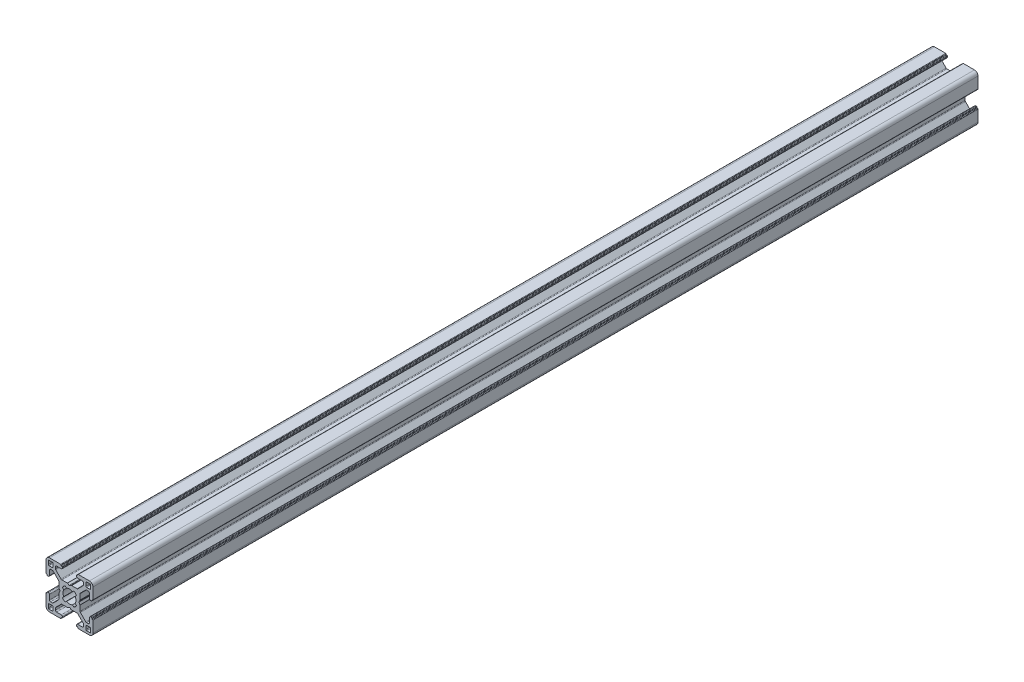
from build123d import *

# Parameters (mm, degrees)
ESTRUSIONE_ESTRUSIONE1_DEPTH = 377


with BuildPart() as part:
    # Schizzo1 → Estrusione-Estrusione1 (new body)
    with BuildSketch(Plane.XY.offset(100)):
        with BuildLine():
            Line((-9.299999732, 3), (-8.999999732, 3))
            ThreePointArc((-8.999999732, 3), (-8.646446341, 3.146446609), (-8.499999732, 3.5))
            Line((-8.499999732, 3.5), (-8.499999732, 5.499999605))
            ThreePointArc((-8.499999732, 5.499999605), (-8.353553123, 5.853552995), (-7.999999732, 5.999999605))
            Line((-7.999999732, 5.999999605), (-7.267766685, 5.999999605))
            ThreePointArc((-7.267766685, 5.999999605), (-7.076424969, 5.961939371), (-6.914213294, 5.853552995))
            Line((-6.914213294, 5.853552995), (-4.646446398, 3.585786099))
            ThreePointArc((-4.646446398, 3.585786099), (-4.538060023, 3.423574425), (-4.499999789, 3.232232708))
            Line((-4.499999789, 3.232232708), (-4.499999789, 0.953589302))
            ThreePointArc((-4.499999789, 0.953589302), (-4.493184953, 0.90182549), (-4.473204867, 0.853589297))
            Line((-4.473204867, 0.853589297), (-4.038119841, 0.099999969))
            ThreePointArc((-4.038119841, 0.099999969), (-4.011324929, 0), (-4.038119841, -0.099999969))
            Line((-4.038119841, -0.099999969), (-4.473204867, -0.853589297))
            ThreePointArc((-4.473204867, -0.853589297), (-4.493184953, -0.90182549), (-4.499999789, -0.953589302))
            Line((-4.499999789, -0.953589302), (-4.499999789, -3.232232708))
            ThreePointArc((-4.499999789, -3.232232708), (-4.538060023, -3.423574425), (-4.646446398, -3.585786099))
            Line((-4.646446398, -3.585786099), (-6.914213294, -5.853552995))
            ThreePointArc((-6.914213294, -5.853552995), (-7.076424969, -5.961939371), (-7.267766685, -5.999999605))
            Line((-7.267766685, -5.999999605), (-7.999999732, -5.999999605))
            ThreePointArc((-7.999999732, -5.999999605), (-8.353553123, -5.853552995), (-8.499999732, -5.499999605))
            Line((-8.499999732, -5.499999605), (-8.499999732, -3.5))
            ThreePointArc((-8.499999732, -3.5), (-8.646446341, -3.146446609), (-8.999999732, -3))
            Line((-8.999999732, -3), (-9.299999732, -3))
            ThreePointArc((-9.299999732, -3), (-9.441421088, -3.058578644), (-9.499999732, -3.2))
            Line((-9.499999732, -3.2), (-9.499999732, -3.349999605))
            ThreePointArc((-9.499999732, -3.349999605), (-9.558578376, -3.491420961), (-9.699999732, -3.549999605))
            Line((-9.699999732, -3.549999605), (-9.8, -3.549999605))
            ThreePointArc((-9.8, -3.549999605), (-9.941421356, -3.608578248), (-10, -3.749999605))
            Line((-10, -3.749999605), (-10, -8.5))
            ThreePointArc((-10, -8.5), (-9.560660172, -9.560660172), (-8.5, -10))
            Line((-8.5, -10), (-3.750000228, -10))
            ThreePointArc((-3.750000228, -10), (-3.608578871, -9.941421356), (-3.550000228, -9.8))
            Line((-3.550000228, -9.8), (-3.550000228, -9.7))
            ThreePointArc((-3.550000228, -9.7), (-3.491421584, -9.558578644), (-3.350000228, -9.5))
            Line((-3.350000228, -9.5), (-3.2, -9.5))
            ThreePointArc((-3.2, -9.5), (-3.058578644, -9.441421356), (-3, -9.3))
            Line((-3, -9.3), (-3, -8.999999673))
            ThreePointArc((-3, -8.999999673), (-3.146446609, -8.646446283), (-3.5, -8.499999673))
            Line((-3.5, -8.499999673), (-5.500000686, -8.499999673))
            ThreePointArc((-5.500000686, -8.499999673), (-5.853554077, -8.353553064), (-6.000000686, -7.999999673))
            Line((-6.000000686, -7.999999673), (-6.000000686, -7.267766626))
            ThreePointArc((-6.000000686, -7.267766626), (-5.961940448, -7.076424899), (-5.853554059, -6.914213219))
            Line((-5.853554059, -6.914213219), (-3.585787212, -4.646446592))
            ThreePointArc((-3.585787212, -4.646446592), (-3.423575544, -4.538060229), (-3.232233839, -4.5))
            Line((-3.232233839, -4.5), (-0.953590312, -4.5))
            ThreePointArc((-0.953590312, -4.5), (-0.901826505, -4.493185166), (-0.853590316, -4.473205083))
            Line((-0.853590316, -4.473205083), (-0.100000045, -4.038119562))
            ThreePointArc((-0.100000045, -4.038119562), (0, -4.011324632), (0.100000045, -4.038119562))
            Line((0.100000045, -4.038119562), (0.853590316, -4.473205083))
            ThreePointArc((0.853590316, -4.473205083), (0.901826505, -4.493185166), (0.953590312, -4.5))
            Line((0.953590312, -4.5), (3.23223292, -4.5))
            ThreePointArc((3.23223292, -4.5), (3.423574636, -4.538060234), (3.58578631, -4.646446609))
            Line((3.58578631, -4.646446609), (5.853554077, -6.914214376))
            ThreePointArc((5.853554077, -6.914214376), (5.961940452, -7.07642605), (6.000000686, -7.267767766))
            Line((6.000000686, -7.267767766), (6.000000686, -7.999999673))
            ThreePointArc((6.000000686, -7.999999673), (5.853554077, -8.353553064), (5.500000686, -8.499999673))
            Line((5.500000686, -8.499999673), (3.5, -8.499999673))
            ThreePointArc((3.5, -8.499999673), (3.146446609, -8.646446283), (3, -8.999999673))
            Line((3, -8.999999673), (3, -9.3))
            ThreePointArc((3, -9.3), (3.058578644, -9.441421356), (3.2, -9.5))
            Line((3.2, -9.5), (3.350000228, -9.5))
            ThreePointArc((3.350000228, -9.5), (3.491421584, -9.558578644), (3.550000228, -9.7))
            Line((3.550000228, -9.7), (3.550000228, -9.8))
            ThreePointArc((3.550000228, -9.8), (3.608578871, -9.941421356), (3.750000228, -10))
            Line((3.750000228, -10), (8.5, -10))
            ThreePointArc((8.5, -10), (9.560660172, -9.560660172), (10, -8.5))
            Line((10, -8.5), (10, -3.749999605))
            ThreePointArc((10, -3.749999605), (9.941421356, -3.608578248), (9.8, -3.549999605))
            Line((9.8, -3.549999605), (9.699999732, -3.549999605))
            ThreePointArc((9.699999732, -3.549999605), (9.558578376, -3.491420961), (9.499999732, -3.349999605))
            Line((9.499999732, -3.349999605), (9.499999732, -3.2))
            ThreePointArc((9.499999732, -3.2), (9.441421088, -3.058578644), (9.299999732, -3))
            Line((9.299999732, -3), (8.999999732, -3))
            ThreePointArc((8.999999732, -3), (8.646446341, -3.146446609), (8.499999732, -3.5))
            Line((8.499999732, -3.5), (8.499999732, -5.499999605))
            ThreePointArc((8.499999732, -5.499999605), (8.353553123, -5.853552995), (7.999999732, -5.999999605))
            Line((7.999999732, -5.999999605), (7.267766789, -5.999999605))
            ThreePointArc((7.267766789, -5.999999605), (7.076425084, -5.961939376), (6.914213416, -5.853553012))
            Line((6.914213416, -5.853553012), (4.646446415, -3.585786233))
            ThreePointArc((4.646446415, -3.585786233), (4.538060027, -3.423574553), (4.499999789, -3.232232825))
            Line((4.499999789, -3.232232825), (4.499999789, -0.953589302))
            ThreePointArc((4.499999789, -0.953589302), (4.493184953, -0.90182549), (4.473204867, -0.853589297))
            Line((4.473204867, -0.853589297), (4.038119841, -0.099999969))
            ThreePointArc((4.038119841, -0.099999969), (4.011324929, 0), (4.038119841, 0.099999969))
            Line((4.038119841, 0.099999969), (4.473204867, 0.853589297))
            ThreePointArc((4.473204867, 0.853589297), (4.493184953, 0.90182549), (4.499999789, 0.953589302))
            Line((4.499999789, 0.953589302), (4.499999789, 3.232232825))
            ThreePointArc((4.499999789, 3.232232825), (4.538060027, 3.423574553), (4.646446415, 3.585786233))
            Line((4.646446415, 3.585786233), (6.914213416, 5.853553012))
            ThreePointArc((6.914213416, 5.853553012), (7.076425084, 5.961939376), (7.267766789, 5.999999605))
            Line((7.267766789, 5.999999605), (7.999999732, 5.999999605))
            ThreePointArc((7.999999732, 5.999999605), (8.353553123, 5.853552995), (8.499999732, 5.499999605))
            Line((8.499999732, 5.499999605), (8.499999732, 3.5))
            ThreePointArc((8.499999732, 3.5), (8.646446341, 3.146446609), (8.999999732, 3))
            Line((8.999999732, 3), (9.299999732, 3))
            ThreePointArc((9.299999732, 3), (9.441421088, 3.058578644), (9.499999732, 3.2))
            Line((9.499999732, 3.2), (9.499999732, 3.349999605))
            ThreePointArc((9.499999732, 3.349999605), (9.558578376, 3.491420961), (9.699999732, 3.549999605))
            Line((9.699999732, 3.549999605), (9.8, 3.549999605))
            ThreePointArc((9.8, 3.549999605), (9.941421356, 3.608578248), (10, 3.749999605))
            Line((10, 3.749999605), (10, 8.5))
            ThreePointArc((10, 8.5), (9.560660172, 9.560660172), (8.5, 10))
            Line((8.5, 10), (3.750000228, 10))
            ThreePointArc((3.750000228, 10), (3.608578871, 9.941421356), (3.550000228, 9.8))
            Line((3.550000228, 9.8), (3.550000228, 9.7))
            ThreePointArc((3.550000228, 9.7), (3.491421584, 9.558578644), (3.350000228, 9.5))
            Line((3.350000228, 9.5), (3.2, 9.5))
            ThreePointArc((3.2, 9.5), (3.058578644, 9.441421356), (3, 9.3))
            Line((3, 9.3), (3, 8.999999673))
            ThreePointArc((3, 8.999999673), (3.146446609, 8.646446283), (3.5, 8.499999673))
            Line((3.5, 8.499999673), (5.500000686, 8.499999673))
            ThreePointArc((5.500000686, 8.499999673), (5.853554077, 8.353553064), (6.000000686, 7.999999673))
            Line((6.000000686, 7.999999673), (6.000000686, 7.267767766))
            ThreePointArc((6.000000686, 7.267767766), (5.961940452, 7.07642605), (5.853554077, 6.914214376))
            Line((5.853554077, 6.914214376), (3.58578631, 4.646446609))
            ThreePointArc((3.58578631, 4.646446609), (3.423574636, 4.538060234), (3.23223292, 4.5))
            Line((3.23223292, 4.5), (0.953590312, 4.5))
            ThreePointArc((0.953590312, 4.5), (0.901826505, 4.493185166), (0.853590316, 4.473205083))
            Line((0.853590316, 4.473205083), (0.100000045, 4.038119562))
            ThreePointArc((0.100000045, 4.038119562), (0, 4.011324632), (-0.100000045, 4.038119562))
            Line((-0.100000045, 4.038119562), (-0.853590316, 4.473205083))
            ThreePointArc((-0.853590316, 4.473205083), (-0.901826505, 4.493185166), (-0.953590312, 4.5))
            Line((-0.953590312, 4.5), (-3.232233839, 4.5))
            ThreePointArc((-3.232233839, 4.5), (-3.423575544, 4.538060229), (-3.585787212, 4.646446592))
            Line((-3.585787212, 4.646446592), (-5.853554059, 6.914213219))
            ThreePointArc((-5.853554059, 6.914213219), (-5.961940448, 7.076424899), (-6.000000686, 7.267766626))
            Line((-6.000000686, 7.267766626), (-6.000000686, 7.999999673))
            ThreePointArc((-6.000000686, 7.999999673), (-5.853554077, 8.353553064), (-5.500000686, 8.499999673))
            Line((-5.500000686, 8.499999673), (-3.5, 8.499999673))
            ThreePointArc((-3.5, 8.499999673), (-3.146446609, 8.646446283), (-3, 8.999999673))
            Line((-3, 8.999999673), (-3, 9.3))
            ThreePointArc((-3, 9.3), (-3.058578644, 9.441421356), (-3.2, 9.5))
            Line((-3.2, 9.5), (-3.350000228, 9.5))
            ThreePointArc((-3.350000228, 9.5), (-3.491421584, 9.558578644), (-3.550000228, 9.7))
            Line((-3.550000228, 9.7), (-3.550000228, 9.8))
            ThreePointArc((-3.550000228, 9.8), (-3.608578871, 9.941421356), (-3.750000228, 10))
            Line((-3.750000228, 10), (-8.5, 10))
            ThreePointArc((-8.5, 10), (-9.560660172, 9.560660172), (-10, 8.5))
            Line((-10, 8.5), (-10, 3.749999605))
            ThreePointArc((-10, 3.749999605), (-9.941421356, 3.608578248), (-9.8, 3.549999605))
            Line((-9.8, 3.549999605), (-9.699999732, 3.549999605))
            ThreePointArc((-9.699999732, 3.549999605), (-9.558578376, 3.491420961), (-9.499999732, 3.349999605))
            Line((-9.499999732, 3.349999605), (-9.499999732, 3.2))
            ThreePointArc((-9.499999732, 3.2), (-9.441421088, 3.058578644), (-9.299999732, 3))
        make_face()
        with BuildLine():
            Line((-1.91389502, 2.989640962), (-1.258185436, 2.445295362))
            ThreePointArc((-1.258185436, 2.445295362), (0, 2.75), (1.258185436, 2.445295362))
            Line((1.258185436, 2.445295362), (1.91389502, 2.989640962))
            ThreePointArc((1.91389502, 2.989640962), (2.511737261, 2.508410485), (2.992174953, 1.909930962))
            Line((2.992174953, 1.909930962), (2.445295423, 1.258185317))
            ThreePointArc((2.445295423, 1.258185317), (2.75, 0), (2.445295423, -1.258185317))
            Line((2.445295423, -1.258185317), (2.992174953, -1.909930962))
            ThreePointArc((2.992174953, -1.909930962), (2.511737261, -2.508410485), (1.91389502, -2.989640962))
            Line((1.91389502, -2.989640962), (1.258185436, -2.445295362))
            ThreePointArc((1.258185436, -2.445295362), (0, -2.75), (-1.258185436, -2.445295362))
            Line((-1.258185436, -2.445295362), (-1.91389502, -2.989640962))
            ThreePointArc((-1.91389502, -2.989640962), (-2.511737261, -2.508410485), (-2.992174953, -1.909930962))
            Line((-2.992174953, -1.909930962), (-2.445295423, -1.258185317))
            ThreePointArc((-2.445295423, -1.258185317), (-2.75, 0), (-2.445295423, 1.258185317))
            Line((-2.445295423, 1.258185317), (-2.992174953, 1.909930962))
            ThreePointArc((-2.992174953, 1.909930962), (-2.511737261, 2.508410485), (-1.91389502, 2.989640962))
        make_face(mode=Mode.SUBTRACT)
        with BuildLine():
            Line((8.699999314, 7.000000686), (7.3, 7.000000686))
            ThreePointArc((7.3, 7.000000686), (7.087867966, 7.087868652), (7, 7.300000686))
            Line((7, 7.300000686), (7, 8.7))
            ThreePointArc((7, 8.7), (7.087867966, 8.912132034), (7.3, 9))
            Line((7.3, 9), (8.699999314, 9))
            ThreePointArc((8.699999314, 9), (8.912131348, 8.912132034), (8.999999314, 8.7))
            Line((8.999999314, 8.7), (8.999999314, 7.300000686))
            ThreePointArc((8.999999314, 7.300000686), (8.912131348, 7.087868652), (8.699999314, 7.000000686))
        make_face(mode=Mode.SUBTRACT)
        with BuildLine():
            Line((-7.300000686, 7.000000686), (-8.7, 7.000000686))
            ThreePointArc((-8.7, 7.000000686), (-8.912132034, 7.087868652), (-9, 7.300000686))
            Line((-9, 7.300000686), (-9, 8.7))
            ThreePointArc((-9, 8.7), (-8.912132034, 8.912132034), (-8.7, 9))
            Line((-8.7, 9), (-7.300000686, 9))
            ThreePointArc((-7.300000686, 9), (-7.087868652, 8.912132034), (-7.000000686, 8.7))
            Line((-7.000000686, 8.7), (-7.000000686, 7.300000686))
            ThreePointArc((-7.000000686, 7.300000686), (-7.087868652, 7.087868652), (-7.300000686, 7.000000686))
        make_face(mode=Mode.SUBTRACT)
        with BuildLine():
            Line((8.699999314, -8.999999314), (7.3, -8.999999314))
            ThreePointArc((7.3, -8.999999314), (7.087867966, -8.912131348), (7, -8.699999314))
            Line((7, -8.699999314), (7, -7.3))
            ThreePointArc((7, -7.3), (7.087867966, -7.087867966), (7.3, -7))
            Line((7.3, -7), (8.699999314, -7))
            ThreePointArc((8.699999314, -7), (8.912131348, -7.087867966), (8.999999314, -7.3))
            Line((8.999999314, -7.3), (8.999999314, -8.699999314))
            ThreePointArc((8.999999314, -8.699999314), (8.912131348, -8.912131348), (8.699999314, -8.999999314))
        make_face(mode=Mode.SUBTRACT)
        with BuildLine():
            Line((-7.300000686, -8.999999314), (-8.7, -8.999999314))
            ThreePointArc((-8.7, -8.999999314), (-8.912132034, -8.912131348), (-9, -8.699999314))
            Line((-9, -8.699999314), (-9, -7.3))
            ThreePointArc((-9, -7.3), (-8.912132034, -7.087867966), (-8.7, -7))
            Line((-8.7, -7), (-7.300000686, -7))
            ThreePointArc((-7.300000686, -7), (-7.087868652, -7.087867966), (-7.000000686, -7.3))
            Line((-7.000000686, -7.3), (-7.000000686, -8.699999314))
            ThreePointArc((-7.000000686, -8.699999314), (-7.087868652, -8.912131348), (-7.300000686, -8.999999314))
        make_face(mode=Mode.SUBTRACT)
    extrude(amount=-ESTRUSIONE_ESTRUSIONE1_DEPTH)


solid = part.part
